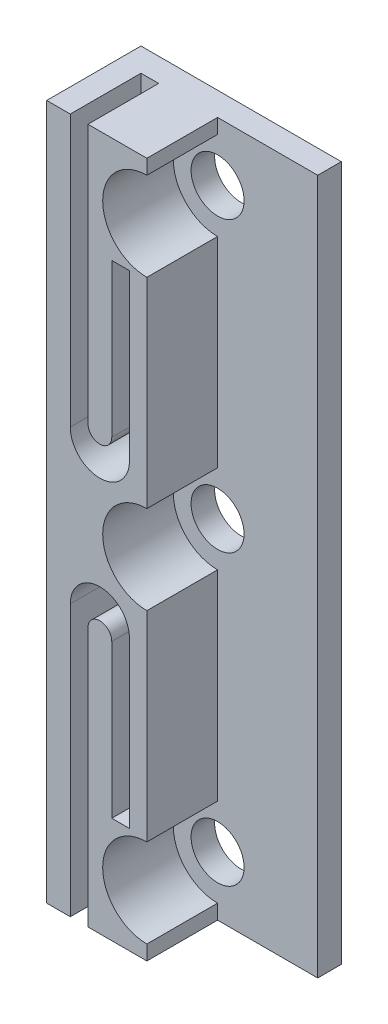
from build123d import *

# Parameters (mm, degrees)
ESQUISSE1_W             = 17
ESQUISSE1_H             = 59
BOSS_EXTRU_1_DEPTH      = 2
ESQUISSE2_W             = 8.5
ESQUISSE2_H             = 59
BOSS_EXTRU_2_DEPTH      = 6
ENL_V_MAT_EXTRU_1_DEPTH = 6
ESQUISSE4_R             = 2.25
ENL_V_MAT_EXTRU_4_DEPTH = 22
ESQUISSE6_R             = 3.75
ENL_V_MAT_EXTRU_5_DEPTH = 6


with BuildPart() as part:
    # Esquisse1 → Boss.-Extru.1 (new body)
    with BuildSketch(Plane.XY):
        with Locations((8.5, -29.5)):
            Rectangle(ESQUISSE1_W, ESQUISSE1_H)
    extrude(amount=BOSS_EXTRU_1_DEPTH)

    # Esquisse2 → Boss.-Extru.2 (add)
    with BuildSketch(Plane.XY.offset(2)):
        with Locations((4.25, -29.5)):
            Rectangle(ESQUISSE2_W, ESQUISSE2_H)
    extrude(amount=BOSS_EXTRU_2_DEPTH)

    # Esquisse3 → Enlèv. mat.-Extru.1 (cut)
    with BuildSketch(Plane.XY.offset(8)):
        with BuildLine():
            Line((2, -36), (2, -59))
            Line((2, -59), (3.5, -59))
            Line((3.5, -59), (3.5, -37))
            ThreePointArc((3.5, -37), (4.509962751, -35.990037249), (5.519925502, -37))
            Line((5.519925502, -37), (5.519925502, -50))
            Line((5.519925502, -50), (7.019925502, -50))
            Line((7.019925502, -50), (7.019925502, -36))
            ThreePointArc((7.019925502, -36), (4.509962751, -33.490037249), (2, -36))
        make_face()
        with BuildLine():
            Line((2, 0), (2, -23))
            ThreePointArc((2, -23), (4.509962751, -25.509962751), (7.019925502, -23))
            Line((7.019925502, -23), (7.019925502, -9))
            Line((7.019925502, -9), (5.519925502, -9))
            Line((5.519925502, -9), (5.519925502, -22))
            ThreePointArc((5.519925502, -22), (4.509962751, -23.009962751), (3.5, -22))
            Line((3.5, -22), (3.5, 0))
            Line((3.5, 0), (2, 0))
        make_face()
    extrude(amount=-ENL_V_MAT_EXTRU_1_DEPTH, mode=Mode.SUBTRACT)

    # Esquisse4 → Enlèv. mat.-Extru.4 (cut)
    with BuildSketch(Plane.XY.offset(8)):
        with Locations((8.5, -29.5)):
            Circle(ESQUISSE4_R)
        with Locations((8.5, -54)):
            Circle(ESQUISSE4_R)
        with Locations((8.5, -5)):
            Circle(ESQUISSE4_R)
    extrude(amount=-ENL_V_MAT_EXTRU_4_DEPTH, mode=Mode.SUBTRACT)

    # Esquisse6 → Enlèv. mat.-Extru.5 (cut)
    with BuildSketch(Plane.XY.offset(8)):
        with Locations((8.5, -29.5)):
            Circle(ESQUISSE6_R)
        with Locations((8.5, -5)):
            Circle(ESQUISSE6_R)
        with Locations((8.5, -54)):
            Circle(ESQUISSE6_R)
    extrude(amount=-ENL_V_MAT_EXTRU_5_DEPTH, mode=Mode.SUBTRACT)


solid = part.part
